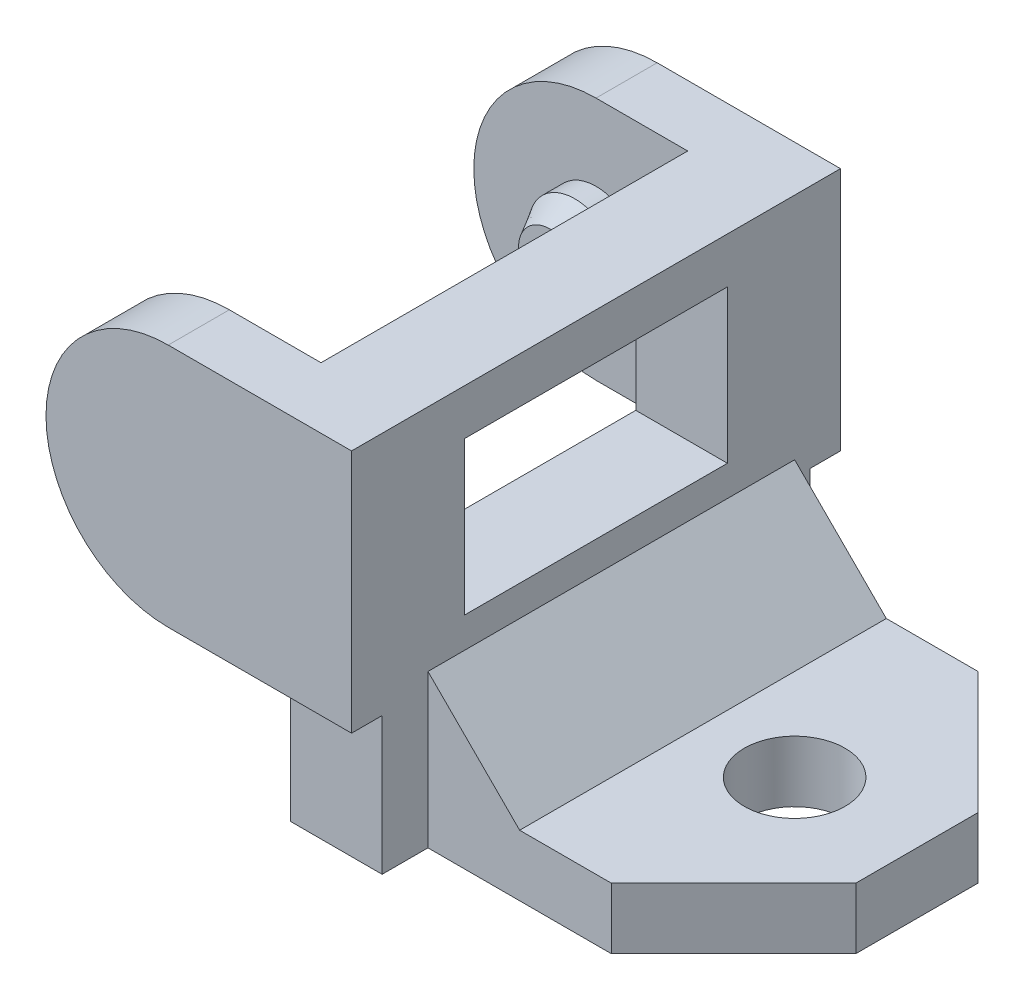
from build123d import *
from OCP.BRepFilletAPI import BRepFilletAPI_MakeChamfer

# Parameters (mm, degrees)
RESSALTO_EXTRUS_O1_DEPTH    = 8
CORTE_EXTRUS_O1_START       = -8
CORTE_EXTRUS_O1_OUTLINE_W   = 7
CORTE_EXTRUS_O1_OUTLINE_H   = 12
CORTE_EXTRUS_O1_OUTLINE_W_2 = 6
CORTE_EXTRUS_O1_OUTLINE_H_2 = 8.6
CORTE_EXTRUS_O1_DEPTH       = 8
CORTE_EXTRUS_O2_DEPTH       = 16.099668871
CORTE_EXTRUS_O2_DEPTH_BACK  = 16.099668871
ESBO_O3_W                   = 8.6
ESBO_O3_H                   = 5
CORTE_EXTRUS_O3_DEPTH       = 18.756407294
CORTE_EXTRUS_O3_DEPTH_BACK  = 18.756407294
ESBO_O4_R                   = 1.65
ESBO_O5_R                   = 1.5
RESSALTO_EXTRUS_O2_DEPTH    = 1.5
FILETE1_R                   = 2
CHANFRO1_SIZE               = 0.8
CHANFRO1_SIZE2              = 0.461880215
ESBO_O7_W                   = 9.300626083
ESBO_O7_H                   = 16
CORTE_EXTRUS_O5_DEPTH       = 10
RESSALTO_EXTRUS_O4_DEPTH    = 7
ESBO_O10_R                  = 1.65
CORTE_EXTRUS_O6_DEPTH       = 18.895530168
CHANFRO2_SIZE               = 3


# Read off the part's stored shape, not the designer's step: Corte-extrusão1
with BuildPart() as part:
    # Esboço1 → Ressalto-extrusão1 (new, symmetric)
    with BuildSketch(Plane.XY):
        with BuildLine():
            Line((-6, 0), (6, 0))
            Line((6, 0), (6, -5.690598923))
            Line((6, -5.690598923), (2, -8))
            Line((2, -8), (-6, -8))
            ThreePointArc((-6, -8), (-10, -4), (-6, 0))
        make_face()
    extrude(amount=RESSALTO_EXTRUS_O1_DEPTH, both=True)

    # Corte-extrusão1 outline → Corte-extrusão1 (cut)
    with BuildSketch(Plane(origin=(0, 0, 0), x_dir=(1, 0, 0), z_dir=(0, 1, 0)).offset(CORTE_EXTRUS_O1_START)):
        with Locations((-6.5, 0)):
            Rectangle(CORTE_EXTRUS_O1_OUTLINE_W, CORTE_EXTRUS_O1_OUTLINE_H)
        with Locations((3, 0)):
            Rectangle(CORTE_EXTRUS_O1_OUTLINE_W_2, CORTE_EXTRUS_O1_OUTLINE_H_2)
    extrude(amount=CORTE_EXTRUS_O1_DEPTH, mode=Mode.SUBTRACT)

    # Esboço3 → Corte-extrusão2 (cut, two sides: drawn at the far end of the back side and taken through both)
    with BuildSketch(Plane(origin=(0, 0, 0), x_dir=(0, 0, -1), z_dir=(1, 0, 0)).offset(-CORTE_EXTRUS_O2_DEPTH_BACK)):
        with Locations((0, -4)):
            Rectangle(ESBO_O3_W, ESBO_O3_H)
    extrude(amount=CORTE_EXTRUS_O2_DEPTH + CORTE_EXTRUS_O2_DEPTH_BACK, mode=Mode.SUBTRACT)

    # Esboço4 → Corte-extrusão3 (cut, two sides: drawn at the far end of the back side and taken through both)
    with BuildSketch(Plane(origin=(0, 0, 4.3), x_dir=(-1, 0, 0), z_dir=(0, 0, -1)).offset(-CORTE_EXTRUS_O3_DEPTH_BACK)):
        with Locations((-3.2, -4)):
            Circle(ESBO_O4_R)
    extrude(amount=CORTE_EXTRUS_O3_DEPTH + CORTE_EXTRUS_O3_DEPTH_BACK, mode=Mode.SUBTRACT)

    # Esboço5 → Ressalto-extrusão2 (add)
    with BuildSketch(Plane(origin=(0, 0, 6), x_dir=(-1, 0, 0), z_dir=(0, 0, -1))):
        with Locations((6, -4)):
            Circle(ESBO_O5_R)
    ressalto_extrus_o2 = extrude(amount=RESSALTO_EXTRUS_O2_DEPTH)

    # Espelhar1: Ressalto-extrusão2 across plane
    add(ressalto_extrus_o2.mirror(Plane.XY))

    # Filete1
    filete1_edges = [part.edges().sort_by_distance(p)[0] for p in [
        (6, -5.690598923, -6.15),
        (6, -5.690598923, 6.15),
    ]]
    fillet(filete1_edges, radius=FILETE1_R)

    # Chanfro1: one chamfer whose edges measure the first distance from different faces: ONE call of the kernel's chamfer builder (chamfer() names one face for all edges)
    chanfro1_edges_1 = [part.edges().sort_by_distance(p)[0] for p in [
        (-4.5, -4, 4.5),
    ]]
    chanfro1_side_1 = [part.faces().sort_by_distance(p)[0] for p in [
        (-4.5, -4, 5.25),
    ]]
    chanfro1_edges_2 = [part.edges().sort_by_distance(p)[0] for p in [
        (-4.5, -4, -4.5),
    ]]
    chanfro1_side_2 = [part.faces().sort_by_distance(p)[0] for p in [
        (-4.5, -4, -5.25),
    ]]
    chanfro1_edges_3 = [part.edges().sort_by_distance(p)[0] for p in [
        (4.85, -4, -4.3),
    ]]
    chanfro1_side_3 = [part.faces().sort_by_distance(p)[0] for p in [
        (4.85, -4, -6.15),
    ]]
    chanfro1_edges_4 = [part.edges().sort_by_distance(p)[0] for p in [
        (4.85, -4, 4.3),
    ]]
    chanfro1_side_4 = [part.faces().sort_by_distance(p)[0] for p in [
        (4.85, -4, 6.15),
    ]]
    chanfro1 = BRepFilletAPI_MakeChamfer(part.part.solid().wrapped)
    for e in chanfro1_edges_1:
        chanfro1.Add(CHANFRO1_SIZE, CHANFRO1_SIZE2, e.wrapped, chanfro1_side_1[0].wrapped)  # the first distance lies on this face
    for e in chanfro1_edges_2:
        chanfro1.Add(CHANFRO1_SIZE, CHANFRO1_SIZE2, e.wrapped, chanfro1_side_2[0].wrapped)  # the first distance lies on this face
    for e in chanfro1_edges_3:
        chanfro1.Add(CHANFRO1_SIZE, CHANFRO1_SIZE2, e.wrapped, chanfro1_side_3[0].wrapped)  # the first distance lies on this face
    for e in chanfro1_edges_4:
        chanfro1.Add(CHANFRO1_SIZE, CHANFRO1_SIZE2, e.wrapped, chanfro1_side_4[0].wrapped)  # the first distance lies on this face
    add(Compound.cast(chanfro1.Shape()), mode=Mode.REPLACE)

    # Esboço7 → Corte-extrusão5 (cut)
    with BuildSketch(Plane(origin=(0, 0, 0), x_dir=(1, 0, 0), z_dir=(0, 1, 0))):
        with Locations((4.650313042, 0)):
            Rectangle(ESBO_O7_W, ESBO_O7_H)
    extrude(amount=-CORTE_EXTRUS_O5_DEPTH, mode=Mode.SUBTRACT)

    # Esboço9 → Ressalto-extrusão4 (add, symmetric)
    with BuildSketch(Plane.XY):
        Polygon((0, -8), (0, -10.5), (10, -10.5), (10, -12.5), (-3, -12.5), (-3, -8), align=None)
    extrude(amount=RESSALTO_EXTRUS_O4_DEPTH, both=True)

    # Esboço10 → Corte-extrusão6 (cut, through all)
    with BuildSketch(Plane(origin=(0, 0, 0), x_dir=(1, 0, 0), z_dir=(0, 1, 0))):
        with Locations(Location((6, 0.5, 0), (0, 0, 180))):
            Circle(ESBO_O10_R)
        Polygon((6, 6.5), (10, 2.5), (10, 8), (5.06809326, 8), (0, 8), (0, 6.5), align=None)
        Polygon((10, -1.5), (6, -5.5), (0, -5.5), (0, -8), (10, -8), align=None)
    extrude(amount=-CORTE_EXTRUS_O6_DEPTH, mode=Mode.SUBTRACT)

    # Chanfro2
    chanfro2_edges = [part.edges().sort_by_distance(p)[0] for p in [
        (0, -10.5, -0.5),
    ]]
    chamfer(chanfro2_edges, length=CHANFRO2_SIZE)


solid = part.part
